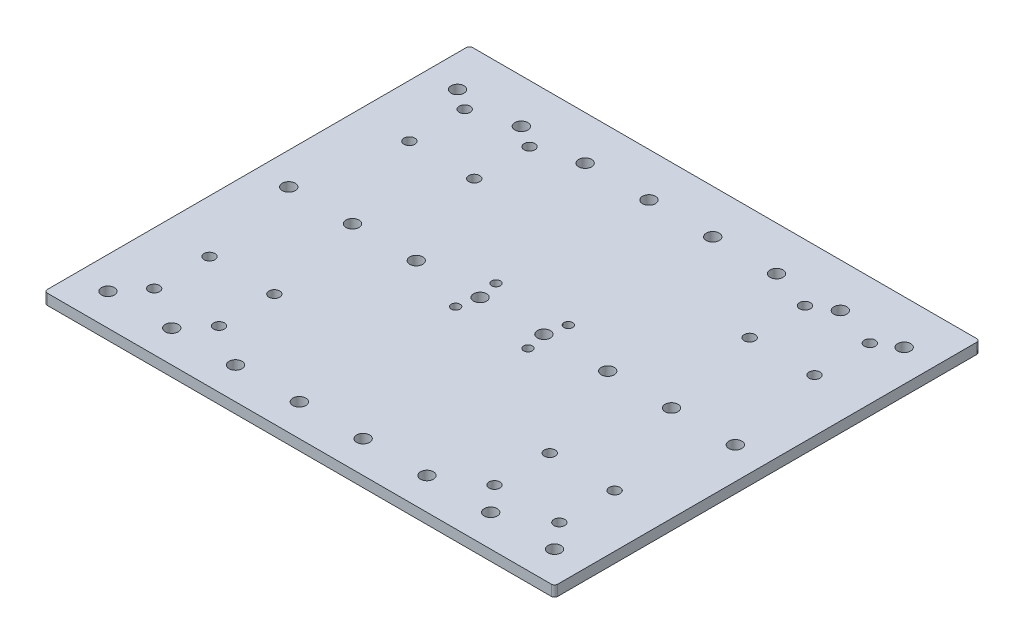
from build123d import *

# Parameters (mm, degrees)
SKETCH1_W           = 240
SKETCH1_H           = 200
BOSS_EXTRUDE1_DEPTH = 2.5
SKETCH2_R           = 2.55
CUT_EXTRUDE1_DEPTH  = 157.284996081
SKETCH3_R           = 2.05
CUT_EXTRUDE2_DEPTH  = 157.284996081
SKETCH4_R           = 3.05
CUT_EXTRUDE3_DEPTH  = 157.284996081
FILLET1_R           = 1.5


with BuildPart() as part:
    # Sketch1 → Boss-Extrude1 (new, symmetric)
    with BuildSketch(Plane(origin=(0, 0, 0), x_dir=(1, 0, 0), z_dir=(0, 1, 0))):
        Rectangle(SKETCH1_W, SKETCH1_H)
    extrude(amount=BOSS_EXTRUDE1_DEPTH, both=True)

    # Sketch2 → Cut-Extrude1 (cut, through all)
    with BuildSketch(Plane(origin=(0, 2.5, 0), x_dir=(1, 0, 0), z_dir=(0, 1, 0))):
        with Locations((-95.25, 73)):
            Circle(SKETCH2_R)
        with Locations((-95.25, 47)):
            Circle(SKETCH2_R)
        with Locations((-64.75, 73)):
            Circle(SKETCH2_R)
        with Locations((-64.75, 47)):
            Circle(SKETCH2_R)
        with Locations((-95.25, -47)):
            Circle(SKETCH2_R)
        with Locations((-95.25, -73)):
            Circle(SKETCH2_R)
        with Locations((-64.75, -73)):
            Circle(SKETCH2_R)
        with Locations((-64.75, -47)):
            Circle(SKETCH2_R)
        with Locations((95.25, -47)):
            Circle(SKETCH2_R)
        with Locations((64.75, -47)):
            Circle(SKETCH2_R)
        with Locations((64.75, -73)):
            Circle(SKETCH2_R)
        with Locations((95.25, -73)):
            Circle(SKETCH2_R)
        with Locations((64.75, 73)):
            Circle(SKETCH2_R)
        with Locations((64.75, 47)):
            Circle(SKETCH2_R)
        with Locations((95.25, 73)):
            Circle(SKETCH2_R)
        with Locations((95.25, 47)):
            Circle(SKETCH2_R)
    extrude(amount=-CUT_EXTRUDE1_DEPTH, mode=Mode.SUBTRACT)

    # Sketch3 → Cut-Extrude2 (cut, through all)
    with BuildSketch(Plane(origin=(0, 2.5, 0), x_dir=(1, 0, 0), z_dir=(0, 1, 0))):
        with Locations((-17, 9.5)):
            Circle(SKETCH3_R)
        with Locations((17, 9.5)):
            Circle(SKETCH3_R)
        with Locations((17, -9.5)):
            Circle(SKETCH3_R)
        with Locations((-17, -9.5)):
            Circle(SKETCH3_R)
    extrude(amount=-CUT_EXTRUDE2_DEPTH, mode=Mode.SUBTRACT)

    # Sketch4 → Cut-Extrude3 (cut, through all)
    with BuildSketch(Plane(origin=(0, 2.5, 0), x_dir=(1, 0, 0), z_dir=(0, 1, 0))):
        with Locations((-105, 79.393522691)):
            Circle(SKETCH4_R)
        with Locations((-75, 79.393522691)):
            Circle(SKETCH4_R)
        with Locations((-45, 79.393522691)):
            Circle(SKETCH4_R)
        with Locations((-15, 79.393522691)):
            Circle(SKETCH4_R)
        with Locations((15, 79.393522691)):
            Circle(SKETCH4_R)
        with Locations((45, 79.393522691)):
            Circle(SKETCH4_R)
        with Locations((75, 79.393522691)):
            Circle(SKETCH4_R)
        with Locations((105, 79.393522691)):
            Circle(SKETCH4_R)
        with Locations((-105, 0)):
            Circle(SKETCH4_R)
        with Locations((-105, -85)):
            Circle(SKETCH4_R)
        with Locations((-75, 0)):
            Circle(SKETCH4_R)
        with Locations((-45, 0)):
            Circle(SKETCH4_R)
        with Locations((-15, 0)):
            Circle(SKETCH4_R)
        with Locations((15, 0)):
            Circle(SKETCH4_R)
        with Locations((45, 0)):
            Circle(SKETCH4_R)
        with Locations((75, 0)):
            Circle(SKETCH4_R)
        with Locations((105, 0)):
            Circle(SKETCH4_R)
        with Locations((-75, -85)):
            Circle(SKETCH4_R)
        with Locations((-45, -85)):
            Circle(SKETCH4_R)
        with Locations((-15, -85)):
            Circle(SKETCH4_R)
        with Locations((15, -85)):
            Circle(SKETCH4_R)
        with Locations((45, -85)):
            Circle(SKETCH4_R)
        with Locations((75, -85)):
            Circle(SKETCH4_R)
        with Locations((105, -85)):
            Circle(SKETCH4_R)
    extrude(amount=-CUT_EXTRUDE3_DEPTH, mode=Mode.SUBTRACT)

    # Fillet1
    fillet1_edges = [part.edges().sort_by_distance(p)[0] for p in [
        (-120, 0, -100),
        (120, 0, -100),
        (-120, 0, 100),
        (120, 0, 100),
    ]]
    fillet(fillet1_edges, radius=FILLET1_R)


solid = part.part
